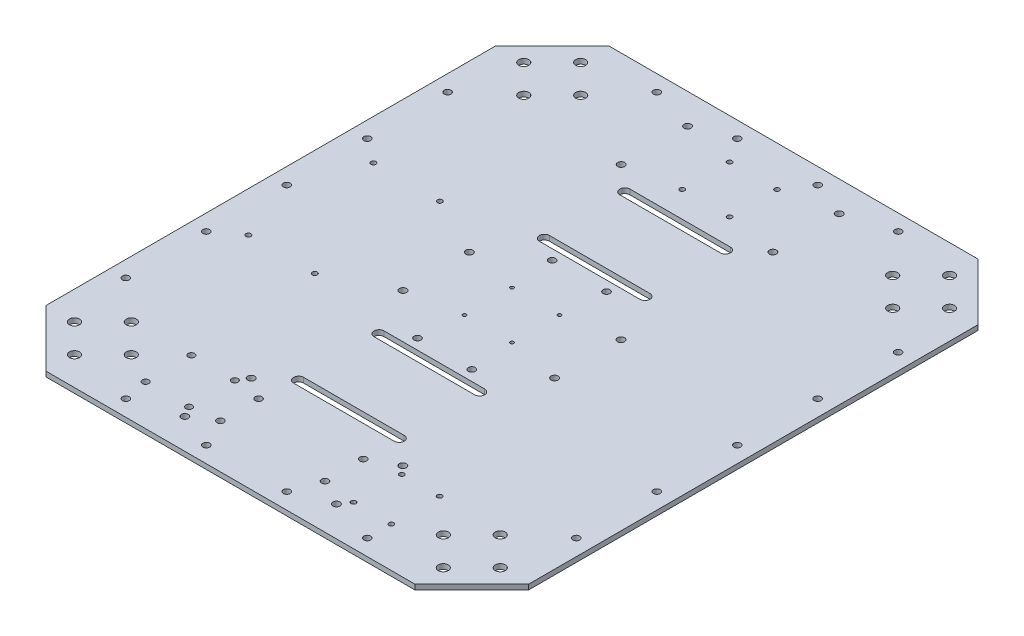
from build123d import *

# Parameters (mm, degrees)
SKETCH1_R               = 2.2225
BOSS_EXTRUDE1_DEPTH     = 3.175
SKETCH2_R               = 2.159
CUT_EXTRUDE1_DEPTH      = 297.247830215
CUT_EXTRUDE2_DEPTH      = 297.247830215
SKETCH7_R               = 1.524
CUT_EXTRUDE3_DEPTH      = 297.247830215
CUT_EXTRUDE4_DEPTH      = 297.247830215
CUT_EXTRUDE4_DEPTH_BACK = 297.247830215
SKETCH8_R               = 1.524
SKETCH9_R               = 2.032
CUT_EXTRUDE5_DEPTH      = 297.247830215
SKETCH10_R              = 2.159
CUT_EXTRUDE6_DEPTH      = 297.247830215
SKETCH12_R              = 1.575
CUT_EXTRUDE7_DEPTH      = 297.247830215
SKETCH13_R              = 1.1
CUT_EXTRUDE8_DEPTH      = 297.247830215
SKETCH14_R              = 3.175
CUT_EXTRUDE9_DEPTH      = 297.247830215
SKETCH15_R              = 2.159
CUT_EXTRUDE10_DEPTH     = 297.247830215


with BuildPart() as part:
    # Sketch1 → Boss-Extrude1 (new body)
    with BuildSketch(Plane(origin=(0, 0, 0), x_dir=(1, 0, 0), z_dir=(0, 1, 0))):
        Polygon((-85.365028143, 123.058976948), (-121.286052627, 87.137952464), (-121.286052627, -196.619998567), (-85.365028143, -232.541023052), (147.592922888, -232.541023052), (183.513947373, -196.619998567), (183.513947373, 87.137952464), (147.592922888, 123.058976948), align=None)
        with Locations((-16.765052627, -213.491023052)):
            Circle(SKETCH1_R, mode=Mode.SUBTRACT)
        with Locations((-16.765052627, -171.581023052)):
            Circle(SKETCH1_R, mode=Mode.SUBTRACT)
        with Locations((-16.765052627, -75.696023052)):
            Circle(SKETCH1_R, mode=Mode.SUBTRACT)
        with Locations((78.992947373, -213.491023052)):
            Circle(SKETCH1_R, mode=Mode.SUBTRACT)
        with Locations((78.992947373, -171.581023052)):
            Circle(SKETCH1_R, mode=Mode.SUBTRACT)
        with Locations((78.992947373, -75.696023052)):
            Circle(SKETCH1_R, mode=Mode.SUBTRACT)
        with Locations((-16.765052627, -33.786023052)):
            Circle(SKETCH1_R, mode=Mode.SUBTRACT)
        with Locations((-16.765052627, 62.098976948)):
            Circle(SKETCH1_R, mode=Mode.SUBTRACT)
        with Locations((-16.765052627, 104.008976948)):
            Circle(SKETCH1_R, mode=Mode.SUBTRACT)
        with Locations((78.992947373, -33.786023052)):
            Circle(SKETCH1_R, mode=Mode.SUBTRACT)
        with Locations((78.992947373, 62.098976948)):
            Circle(SKETCH1_R, mode=Mode.SUBTRACT)
        with Locations((78.992947373, 104.008976948)):
            Circle(SKETCH1_R, mode=Mode.SUBTRACT)
    extrude(amount=BOSS_EXTRUDE1_DEPTH)

    # Sketch2 → Cut-Extrude1 (cut, through all)
    with BuildSketch(Plane(origin=(0, 3.175, 0), x_dir=(1, 0, 0), z_dir=(0, 1, 0))):
        with Locations((13.841947373, -12.069023052)):
            Circle(SKETCH2_R)
        with Locations((48.131947373, -12.069023052)):
            Circle(SKETCH2_R)
        with Locations((13.841947373, -97.159023052)):
            Circle(SKETCH2_R)
        with Locations((48.131947373, -97.159023052)):
            Circle(SKETCH2_R)
    extrude(amount=-CUT_EXTRUDE1_DEPTH, mode=Mode.SUBTRACT)

    # Sketch4 → Cut-Extrude2 (cut, through all)
    with BuildSketch(Plane(origin=(0, 3.175, 0), x_dir=(1, 0, 0), z_dir=(0, 1, 0))):
        with BuildLine():
            Line((-0.636052627, 51.430976948), (62.863947373, 51.430976948))
            ThreePointArc((62.863947373, 51.430976948), (66.038947373, 48.255976948), (62.863947373, 45.080976948))
            Line((62.863947373, 45.080976948), (-0.636052627, 45.080976948))
            ThreePointArc((-0.636052627, 45.080976948), (-3.811052627, 48.255976948), (-0.636052627, 51.430976948))
        make_face()
        with BuildLine():
            Line((-0.636052627, 0.630976948), (62.863947373, 0.630976948))
            ThreePointArc((62.863947373, 0.630976948), (66.038947373, -2.544023052), (62.863947373, -5.719023052))
            Line((62.863947373, -5.719023052), (-0.636052627, -5.719023052))
            ThreePointArc((-0.636052627, -5.719023052), (-3.811052627, -2.544023052), (-0.636052627, 0.630976948))
        make_face()
        with BuildLine():
            Line((-0.636052627, -110.113023052), (62.863947373, -110.113023052))
            ThreePointArc((62.863947373, -110.113023052), (66.038947373, -106.938023052), (62.863947373, -103.763023052))
            Line((62.863947373, -103.763023052), (-0.636052627, -103.763023052))
            ThreePointArc((-0.636052627, -103.763023052), (-3.811052627, -106.938023052), (-0.636052627, -110.113023052))
        make_face()
        with BuildLine():
            Line((-0.636052627, -160.913023052), (62.863947373, -160.913023052))
            ThreePointArc((62.863947373, -160.913023052), (66.038947373, -157.738023052), (62.863947373, -154.563023052))
            Line((62.863947373, -154.563023052), (-0.636052627, -154.563023052))
            ThreePointArc((-0.636052627, -154.563023052), (-3.811052627, -157.738023052), (-0.636052627, -160.913023052))
        make_face()
    extrude(amount=-CUT_EXTRUDE2_DEPTH, mode=Mode.SUBTRACT)

    # Sketch7 → Cut-Extrude3 (cut, through all)
    with BuildSketch(Plane(origin=(0, 3.175, 0), x_dir=(1, 0, 0), z_dir=(0, 1, 0))):
        with Locations((16.127947373, 67.686976948)):
            Circle(SKETCH7_R)
        with Locations((46.099947373, 67.686976948)):
            Circle(SKETCH7_R)
        with Locations((16.127947373, 97.658976948)):
            Circle(SKETCH7_R)
        with Locations((46.099947373, 97.658976948)):
            Circle(SKETCH7_R)
    extrude(amount=-CUT_EXTRUDE3_DEPTH, mode=Mode.SUBTRACT)

    # Sketch8 → Cut-Extrude4 (cut, two sides: drawn at the far end of the back side and taken through both)
    with BuildSketch(Plane(origin=(0, 3.175, 0), x_dir=(1, 0, 0), z_dir=(0, 1, 0)).offset(-CUT_EXTRUDE4_DEPTH_BACK)):
        with Locations((83.437947373, -207.141023052)):
            Circle(SKETCH8_R)
        with Locations((83.437947373, -176.661023052)):
            Circle(SKETCH8_R)
        with Locations((107.313947373, -207.141023052)):
            Circle(SKETCH8_R)
        with Locations((107.313947373, -176.661023052)):
            Circle(SKETCH8_R)
    extrude(amount=CUT_EXTRUDE4_DEPTH + CUT_EXTRUDE4_DEPTH_BACK, mode=Mode.SUBTRACT)

    # Sketch9 → Cut-Extrude5 (cut, through all)
    with BuildSketch(Plane(origin=(0, 0, 0), x_dir=(-1, 0, 0), z_dir=(0, -1, 0))):
        with Locations((48.134052627, -206.887023052)):
            Circle(SKETCH9_R)
        with Locations((20.702052627, -206.887023052)):
            Circle(SKETCH9_R)
        with Locations((48.134052627, -177.931023052)):
            Circle(SKETCH9_R)
        with Locations((20.702052627, -177.931023052)):
            Circle(SKETCH9_R)
    extrude(amount=-CUT_EXTRUDE5_DEPTH, mode=Mode.SUBTRACT)

    # Sketch10 → Cut-Extrude6 (cut, through all)
    with BuildSketch(Plane.XZ):
        with Locations((-3.176052627, 204.601023052)):
            Circle(SKETCH10_R)
        with Locations((62.863947373, 204.601023052)):
            Circle(SKETCH10_R)
        with Locations((-3.176052627, 180.471023052)):
            Circle(SKETCH10_R)
        with Locations((62.863947373, 180.471023052)):
            Circle(SKETCH10_R)
    extrude(amount=-CUT_EXTRUDE6_DEPTH, mode=Mode.SUBTRACT)

    # Sketch12 → Cut-Extrude7 (cut, through all)
    with BuildSketch(Plane.XZ):
        with Locations((-95.886052627, 94.216023052)):
            Circle(SKETCH12_R)
        with Locations((-95.886052627, 15.266023052)):
            Circle(SKETCH12_R)
        with Locations((-53.936052627, 15.266023052)):
            Circle(SKETCH12_R)
        with Locations((-53.936052627, 94.216023052)):
            Circle(SKETCH12_R)
    extrude(amount=-CUT_EXTRUDE7_DEPTH, mode=Mode.SUBTRACT)

    # Sketch13 → Cut-Extrude8 (cut, through all)
    with BuildSketch(Plane.XZ):
        with Locations((16.113947373, 69.741023052)):
            Circle(SKETCH13_R)
        with Locations((16.113947373, 39.741023052)):
            Circle(SKETCH13_R)
        with Locations((46.113947373, 39.741023052)):
            Circle(SKETCH13_R)
        with Locations((46.113947373, 69.741023052)):
            Circle(SKETCH13_R)
    extrude(amount=-CUT_EXTRUDE8_DEPTH, mode=Mode.SUBTRACT)

    # Sketch14 → Cut-Extrude9 (cut, through all)
    with BuildSketch(Plane.XZ):
        with Locations((-103.325540385, 196.619998567)):
            Circle(SKETCH14_R)
        with Locations((-85.365028143, 214.580510809)):
            Circle(SKETCH14_R)
        with Locations((-85.365028143, 178.659486325)):
            Circle(SKETCH14_R)
        with Locations((-67.404515901, 196.619998567)):
            Circle(SKETCH14_R)
        with Locations((129.632410646, 196.619998567)):
            Circle(SKETCH14_R)
        with Locations((147.592922888, 178.659486325)):
            Circle(SKETCH14_R)
        with Locations((165.55343513, 196.619998567)):
            Circle(SKETCH14_R)
        with Locations((147.592922888, 214.580510809)):
            Circle(SKETCH14_R)
        with Locations((-85.365028143, -105.098464706)):
            Circle(SKETCH14_R)
        with Locations((-103.325540385, -87.137952464)):
            Circle(SKETCH14_R)
        with Locations((-85.365028143, -69.177440222)):
            Circle(SKETCH14_R)
        with Locations((-67.404515901, -87.137952464)):
            Circle(SKETCH14_R)
        with Locations((165.55343513, -87.137952464)):
            Circle(SKETCH14_R)
        with Locations((147.592922888, -69.177440222)):
            Circle(SKETCH14_R)
        with Locations((147.592922888, -105.098464706)):
            Circle(SKETCH14_R)
        with Locations((129.632410646, -87.137952464)):
            Circle(SKETCH14_R)
    extrude(amount=-CUT_EXTRUDE9_DEPTH, mode=Mode.SUBTRACT)

    # Sketch15 → Cut-Extrude10 (cut, through all)
    with BuildSketch(Plane.XZ):
        with Locations((5.713947373, 222.381023052)):
            Circle(SKETCH15_R)
        with Locations((-45.086052627, 222.381023052)):
            Circle(SKETCH15_R)
        with Locations((-111.126052627, 54.741023052)):
            Circle(SKETCH15_R)
        with Locations((-111.126052627, 105.541023052)):
            Circle(SKETCH15_R)
        with Locations((-111.126052627, 156.341023052)):
            Circle(SKETCH15_R)
        with Locations((173.353947373, 156.341023052)):
            Circle(SKETCH15_R)
        with Locations((173.353947373, 105.541023052)):
            Circle(SKETCH15_R)
        with Locations((173.353947373, 54.741023052)):
            Circle(SKETCH15_R)
        with Locations((107.313947373, 222.381023052)):
            Circle(SKETCH15_R)
        with Locations((56.513947373, 222.381023052)):
            Circle(SKETCH15_R)
        with Locations((56.513947373, -112.898976948)):
            Circle(SKETCH15_R)
        with Locations((107.313947373, -112.898976948)):
            Circle(SKETCH15_R)
        with Locations((173.353947373, 3.941023052)):
            Circle(SKETCH15_R)
        with Locations((173.353947373, -46.858976948)):
            Circle(SKETCH15_R)
        with Locations((-111.126052627, -46.858976948)):
            Circle(SKETCH15_R)
        with Locations((-111.126052627, 3.941023052)):
            Circle(SKETCH15_R)
        with Locations((-45.086052627, -112.898976948)):
            Circle(SKETCH15_R)
        with Locations((5.713947373, -112.898976948)):
            Circle(SKETCH15_R)
    extrude(amount=-CUT_EXTRUDE10_DEPTH, mode=Mode.SUBTRACT)


solid = part.part
